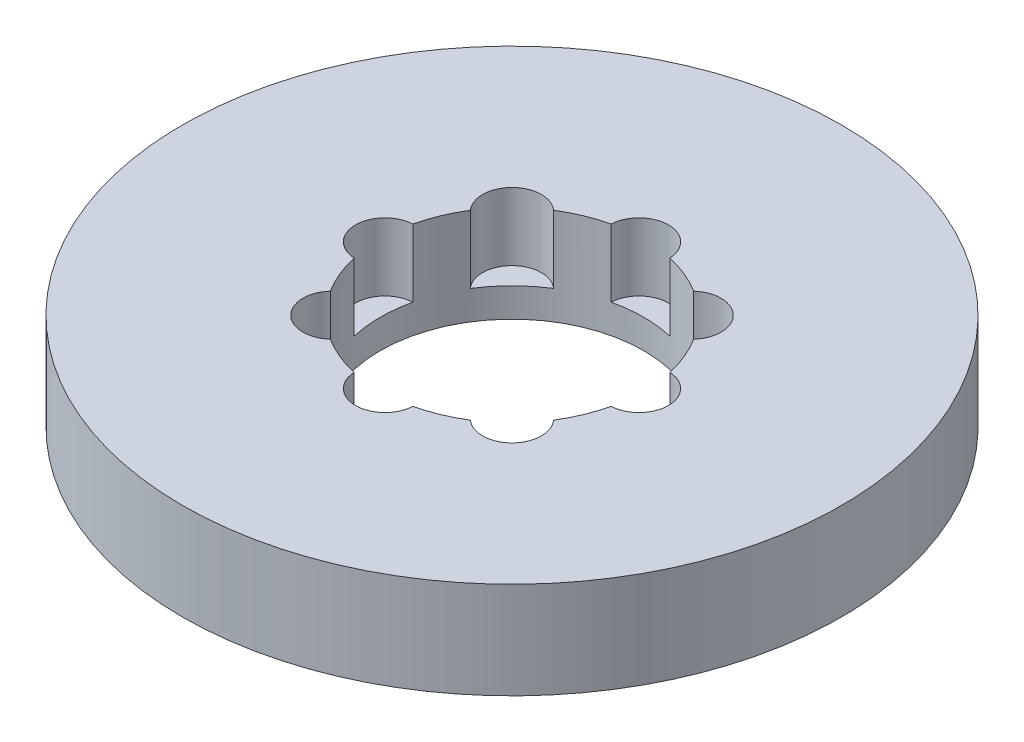
from build123d import *

# Parameters (mm, degrees)
SKETCH1_R           = 37.5
BOSS_EXTRUDE1_DEPTH = 11
SKETCH2_R           = 15
CUT_EXTRUDE1_DEPTH  = 55.161794653
SKETCH3_R           = 3.349732629
CUT_EXTRUDE2_DEPTH  = 7.702556447
CIRPATTERN1_COUNT   = 8


with BuildPart() as part:
    # Sketch1 → Boss-Extrude1 (new body)
    with BuildSketch(Plane(origin=(0, 0, 0), x_dir=(1, 0, 0), z_dir=(0, 1, 0))):
        Circle(SKETCH1_R)
    extrude(amount=BOSS_EXTRUDE1_DEPTH)

    # Sketch2 → Cut-Extrude1 (cut, through all)
    with BuildSketch(Plane(origin=(0, 0, 0), x_dir=(1, 0, 0), z_dir=(0, 1, 0))):
        Circle(SKETCH2_R)
    extrude(amount=CUT_EXTRUDE1_DEPTH, mode=Mode.SUBTRACT)

    # Sketch3 → Cut-Extrude2 (cut)
    with BuildSketch(Plane(origin=(0, 11, 0), x_dir=(1, 0, 0), z_dir=(0, 1, 0))):
        with Locations((-14.45457695, 0)):
            Circle(SKETCH3_R)
    cut_extrude2 = extrude(amount=-CUT_EXTRUDE2_DEPTH, mode=Mode.SUBTRACT)

    # CirPattern1: Cut-Extrude2 ×8 about axis
    cirpattern1_axis = Axis((0, 0, 0), (0, 1, 0))
    for i in range(1, CIRPATTERN1_COUNT):
        add(cut_extrude2.rotate(cirpattern1_axis, i * 360 / CIRPATTERN1_COUNT), mode=Mode.SUBTRACT)


solid = part.part
